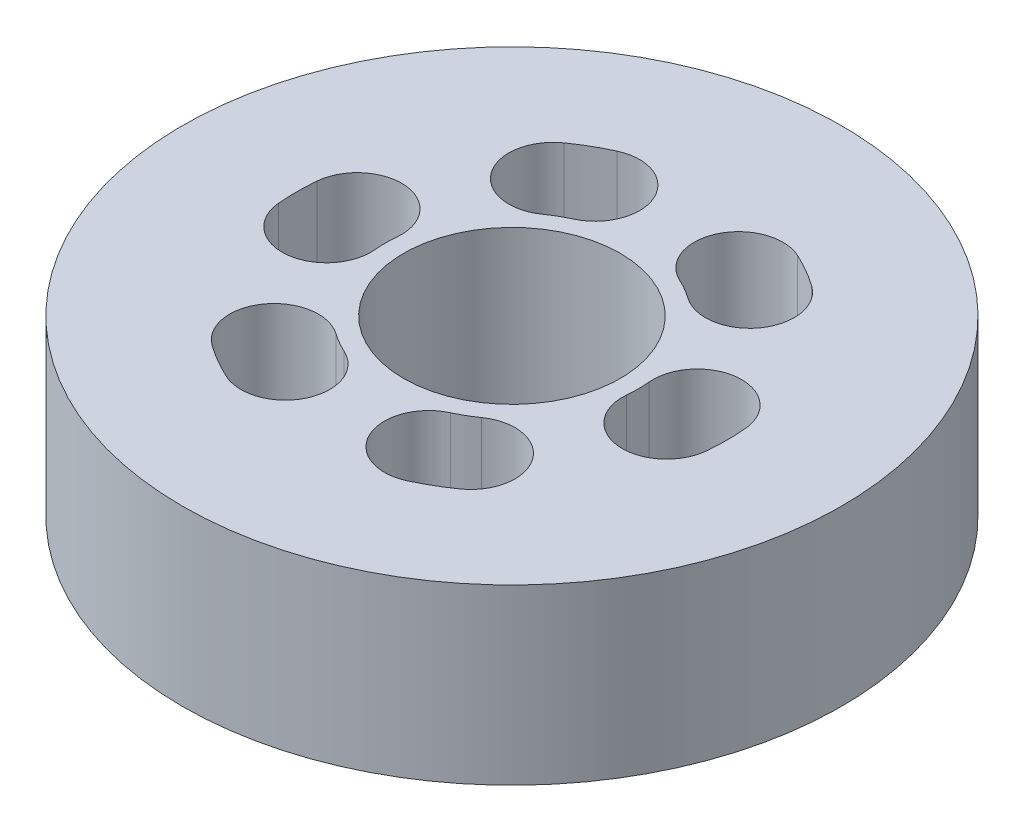
from build123d import *

# Parameters (mm, degrees)
SKETCH1_R           = 24.13
SKETCH1_R_2         = 7.9375
BOSS_EXTRUDE1_DEPTH = 12.7
CUT_EXTRUDE1_DEPTH  = 37.411588815
CIRPATTERN1_COUNT   = 6


with BuildPart() as part:
    # Sketch1 → Boss-Extrude1 (new body)
    with BuildSketch(Plane(origin=(0, 0, 0), x_dir=(1, 0, 0), z_dir=(0, 1, 0))):
        Circle(SKETCH1_R)
        Circle(SKETCH1_R_2, mode=Mode.SUBTRACT)
    extrude(amount=BOSS_EXTRUDE1_DEPTH)

    # Sketch2 → Cut-Extrude1 (cut, through all)
    with BuildSketch(Plane(origin=(0, 12.7, 0), x_dir=(1, 0, 0), z_dir=(0, 1, 0))):
        with BuildLine():
            ThreePointArc((6.615, 14.293504644), (7.875, 13.63990011), (9.071038131, 12.875510368))
            ThreePointArc((9.071038131, 12.875510368), (9.856087957, 8.346857503), (5.327435093, 7.561807676))
            ThreePointArc((5.327435093, 7.561807676), (4.625, 8.010734985), (3.885, 8.394597965))
            ThreePointArc((3.885, 8.394597965), (2.300546661, 12.709051305), (6.615, 14.293504644))
        make_face()
    cut_extrude1 = extrude(amount=-CUT_EXTRUDE1_DEPTH, mode=Mode.SUBTRACT)

    # CirPattern1: Cut-Extrude1 ×6 about axis
    cirpattern1_axis = Axis((0, 12.7, 0), (0, 1, 0))
    for i in range(1, CIRPATTERN1_COUNT):
        add(cut_extrude1.rotate(cirpattern1_axis, i * 360 / CIRPATTERN1_COUNT), mode=Mode.SUBTRACT)


solid = part.part
